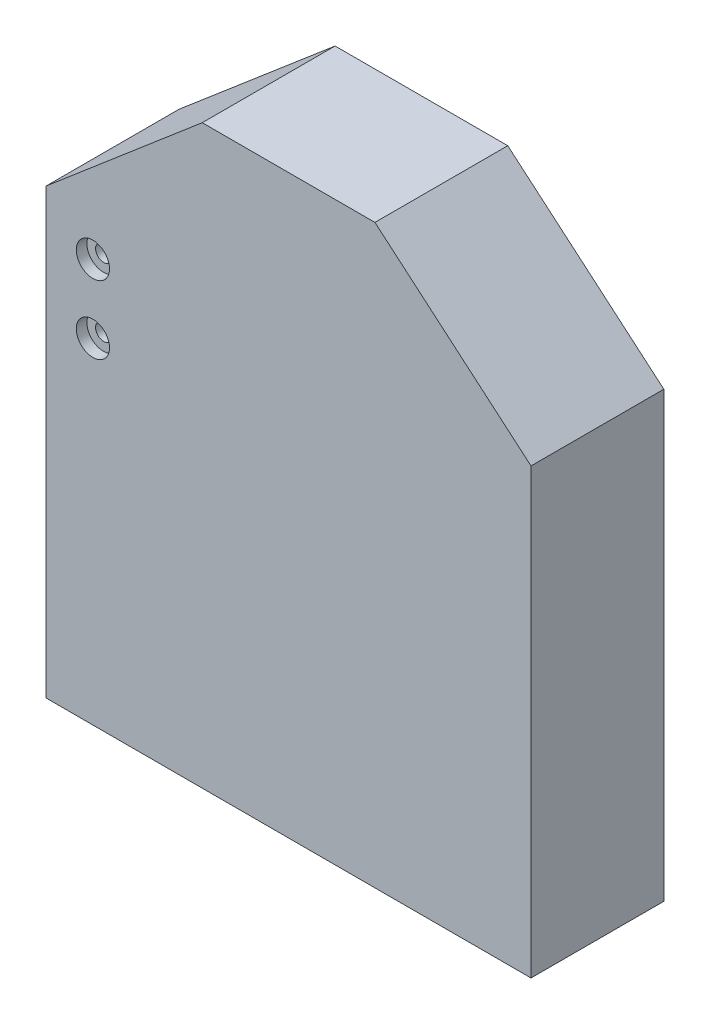
from build123d import *
from build123d.topology import SkipClean

# Parameters (mm, degrees)
BOSS_EXTRUDE5_DEPTH                      = 2
SKETCH1_9_W                              = 14.2
SKETCH1_9_H                              = 15.4
BOSS_EXTRUDE6_DEPTH                      = 12
SKETCH3_R                                = 8.461538462
CUT_EXTRUDE3_DEPTH                       = 12
SKETCH7_W                                = 12
SKETCH7_H                                = 35.1
CUT_EXTRUDE9_DEPTH                       = 3.259623462
SKETCH7_6_W                              = 12
SKETCH7_6_H                              = 35.1
CUT_EXTRUDE10_DEPTH                      = 12
CUT_EXTRUDE11_DEPTH                      = 3.259623462
BOSS_EXTRUDE7_DEPTH                      = 12
BOSS_EXTRUDE8_DEPTH                      = 6
CUT_EXTRUDE14_REACH                      = 66.168
SKETCH9_W                                = 6
SKETCH9_H                                = 24
BOSS_EXTRUDE11_DEPTH                     = 6
BOSS_EXTRUDE11_DEPTH_BACK                = 6
SKETCH6_10_W                             = 12.5
SKETCH6_10_H                             = 8.74037654
CUT_EXTRUDE15_DEPTH                      = 6
CUT_EXTRUDE15_DEPTH_BACK                 = 6
CUT_EXTRUDE16_DEPTH                      = 6
BOSS_EXTRUDE12_DEPTH                     = 6
BOSS_EXTRUDE12_DEPTH_BACK                = 14
CBORE_FOR_M2_PAN_HEAD_SCREW1_D           = 2.4
CBORE_FOR_M2_PAN_HEAD_SCREW1_DEPTH       = 17.6
CBORE_FOR_M2_PAN_HEAD_SCREW1_CBORE_D     = 5
CBORE_FOR_M2_PAN_HEAD_SCREW1_CBORE_DEPTH = 1.6
CBORE_FOR_M2_PAN_HEAD_SCREW1_TIP         = 0.721032743


with BuildPart() as part:
    # Base → Boss-Extrude5 (new body)
    with BuildSketch(Plane.XY):
        Polygon((-13, 50.884615385), (-36.5, 30.884615385), (-36.5, -30.884615385), (36.5, -30.884615385), (36.5, 30.884615385), (13, 50.884615385), align=None)
    extrude(amount=-BOSS_EXTRUDE5_DEPTH)

    # Sketch1<9> → Boss-Extrude6 (add)
    with BuildSketch(Plane.XY):
        Polygon((-13, 50.884615385), (-36.5, 30.884615385), (-36.5, -30.884615385), (36.5, -30.884615385), (36.5, 30.884615385), (13, 50.884615385), align=None)
        Polygon((-11, -27.5), (-21, -27.5), (-21, -0.4), (-29, -0.4), (-29, 3.6), (-21, 3.6), (-21, 5.6), (-11, 5.6), align=None, mode=Mode.SUBTRACT)
        Polygon((21, -27.5), (11, -27.5), (11, 5.6), (21, 5.6), (21, 3.6), (29, 3.6), (29, -0.4), (21, -0.4), align=None, mode=Mode.SUBTRACT)
        with Locations((25.4, 24.8)):
            Rectangle(SKETCH1_9_W, SKETCH1_9_H, mode=Mode.SUBTRACT)
        with Locations((-25.4, 24.8)):
            Rectangle(SKETCH1_9_W, SKETCH1_9_H, mode=Mode.SUBTRACT)
    extrude(amount=BOSS_EXTRUDE6_DEPTH)

    # Toilet → Cut-Revolve2 (revolve, cut)
    with BuildSketch(Plane.YZ):
        with BuildLine():
            Line((46, 12), (33.5, 12))
            Line((33.5, 12), (33.5, 0))
            Line((33.5, 0), (41.961538462, 0))
            Line((41.961538462, 0), (41.961538462, 2.20833333))
            ThreePointArc((41.961538462, 2.20833333), (42.836812261, 6.181610854), (46, 8.74037654))
            Line((46, 8.74037654), (46, 12))
        make_face()
    revolve(axis=Axis((0, 33.5, 12), (0, 0, -1)), mode=Mode.SUBTRACT)

    # Sketch3 → Cut-Extrude3 (cut)
    with BuildSketch(Plane.XY.offset(2.20833333)):
        with Locations((0, 33.5)):
            Circle(SKETCH3_R)
    extrude(amount=-CUT_EXTRUDE3_DEPTH, mode=Mode.SUBTRACT)

    # Sketch7 → Cut-Extrude9 (cut)
    with SkipClean():  # the faces are left unmerged after this step: merging them gives an invalid solid
        with BuildSketch(Plane.XY.offset(12)):
            with Locations((0, -9.95)):
                Rectangle(SKETCH7_W, SKETCH7_H)
            with BuildLine():
                add(Edge.make_bspline(
                    [(16.5, 33.5), (16.5, 48), (0, 48), (-16.5, 48), (-16.5, 33.5)],
                    knots=[3.141592654, 3.141592654, 3.141592654, 4.71238898, 4.71238898, 6.283185307, 6.283185307, 6.283185307], degree=2, weights=[1, 0.707106781, 1, 0.707106781, 1]))
                add(Edge.make_bspline(
                    [(-16.5, 33.5), (-16.5, 19), (0, 19), (16.5, 19), (16.5, 33.5)],
                    knots=[0, 0, 0, 1.570796327, 1.570796327, 3.141592654, 3.141592654, 3.141592654], degree=2, weights=[1, 0.707106781, 1, 0.707106781, 1]))
            make_face()
        extrude(amount=-CUT_EXTRUDE9_DEPTH, mode=Mode.SUBTRACT)
    add(part.part.scale(1), mode=Mode.REPLACE)  # the faces are merged on a copy

    # Sketch7<6> → Cut-Extrude10 (cut)
    with SkipClean():  # the faces are left unmerged after this step: merging them gives an invalid solid
        with BuildSketch(Plane.XY.offset(12)):
            with Locations((0, -9.95)):
                Rectangle(SKETCH7_6_W, SKETCH7_6_H)
        extrude(amount=-CUT_EXTRUDE10_DEPTH, mode=Mode.SUBTRACT)

    # Sketch7<7> → Cut-Extrude11 (cut)
    with SkipClean():  # the faces are left unmerged after this step: merging them gives an invalid solid
        with BuildSketch(Plane.XY.offset(12)):
            with BuildLine():
                ThreePointArc((-11.5, 20.6), (-7.431570475, 14.657797107), (-6, 7.6))
                Line((-6, 7.6), (6, 7.6))
                ThreePointArc((6, 7.6), (7.431570475, 14.657797107), (11.5, 20.6))
                ThreePointArc((11.5, 20.6), (15.206279372, 26.582449856), (16.5, 33.5))
                add(Edge.make_bspline(
                    [(16.5, 33.5), (16.5, 48), (0, 48), (-16.5, 48), (-16.5, 33.5)],
                    knots=[3.141592654, 3.141592654, 3.141592654, 4.71238898, 4.71238898, 6.283185307, 6.283185307, 6.283185307], degree=2, weights=[1, 0.707106781, 1, 0.707106781, 1]))
                ThreePointArc((-16.5, 33.5), (-15.206279372, 26.582449856), (-11.5, 20.6))
            make_face()
        extrude(amount=-CUT_EXTRUDE11_DEPTH, mode=Mode.SUBTRACT)

    # Sketch7<5> → Boss-Extrude7 (add)
    with BuildSketch(Plane.XY.offset(12)):
        Polygon((-6, 7.6), (-9, 7.6), (-9, -30.884615385), (9, -30.884615385), (9, 7.6), (6, 7.6), (6, -27.5), (-6, -27.5), align=None)
    extrude(amount=-BOSS_EXTRUDE7_DEPTH)

    # Sketch8 → Boss-Extrude8 (add)
    with BuildSketch(Plane.XY.offset(12)):
        Polygon((-36.5, 30.884615385), (-36.5, -30.884615385), (36.5, -30.884615385), (36.5, 30.884615385), (13, 50.884615385), (-13, 50.884615385), align=None)
    extrude(amount=BOSS_EXTRUDE8_DEPTH)

    # Sketch9 → Cut-Extrude14 (cut, up to next)
    with BuildSketch(Plane.XY.offset(12), mode=Mode.PRIVATE) as cut_extrude14_sk1:
        with Locations((-26, 1.6)):
            Rectangle(SKETCH9_W, SKETCH9_H)
    cut_extrude14_tool1 = extrude(cut_extrude14_sk1.sketch, amount=-CUT_EXTRUDE14_REACH, mode=Mode.PRIVATE) & part.part
    # Sketch9 → Cut-Extrude14 (cut, up to next)
    with BuildSketch(Plane.XY.offset(12), mode=Mode.PRIVATE) as cut_extrude14_sk2:
        with Locations((26, 1.6)):
            Rectangle(SKETCH9_W, SKETCH9_H)
    cut_extrude14_tool2 = extrude(cut_extrude14_sk2.sketch, amount=-CUT_EXTRUDE14_REACH, mode=Mode.PRIVATE) & part.part
    add(cut_extrude14_tool1.solids().sort_by_distance((-26, 1.6, 12))[0], mode=Mode.SUBTRACT)
    add(cut_extrude14_tool2.solids().sort_by_distance((26, 1.6, 12))[0], mode=Mode.SUBTRACT)

    # Sketch6<10> → Boss-Extrude11 (add, two sides: drawn at the far end of the back side and taken through both)
    with BuildSketch(Plane.YZ.offset(-BOSS_EXTRUDE11_DEPTH_BACK)):
        with Locations((1.35, 4.37018827)):
            Rectangle(SKETCH6_10_W, SKETCH6_10_H)
    extrude(amount=BOSS_EXTRUDE11_DEPTH + BOSS_EXTRUDE11_DEPTH_BACK)

    # Sketch6<11> → Cut-Extrude15 (cut, two sides: drawn at the far end of the back side and taken through both)
    with BuildSketch(Plane.YZ.offset(-CUT_EXTRUDE15_DEPTH_BACK)):
        with BuildLine():
            ThreePointArc((4.061538462, 2.20833333), (4.733917765, 6.068528397), (7.6, 8.74037654))
            Line((7.6, 8.74037654), (-4.9, 8.74037654))
            Line((-4.9, 8.74037654), (-4.9, 0))
            Line((-4.9, 0), (4.061538462, 0))
            Line((4.061538462, 0), (4.061538462, 2.20833333))
        make_face()
    extrude(amount=CUT_EXTRUDE15_DEPTH + CUT_EXTRUDE15_DEPTH_BACK, mode=Mode.SUBTRACT)

    # Sketch1<10> → Cut-Extrude16 (cut)
    with BuildSketch(Plane.XY):
        Polygon((-32.5, 27.5), (-32.5, 22.1), (-26.5, 22.1), (-26.5, 17.1), (-22.3, 17.1), (-22.3, 32.5), (-26.5, 32.5), (-26.5, 27.5), align=None)
        Polygon((22.3, 32.5), (22.3, 17.1), (26.5, 17.1), (26.5, 22.1), (32.5, 22.1), (32.5, 27.5), (26.5, 27.5), (26.5, 32.5), align=None)
    extrude(amount=-CUT_EXTRUDE16_DEPTH, mode=Mode.SUBTRACT)

    # Sketch13 → Boss-Extrude12 (add, two sides: drawn at the far end of the back side and taken through both)
    with BuildSketch(Plane.XY.offset(12).offset(-BOSS_EXTRUDE12_DEPTH_BACK)):
        Polygon((36.5, 30.884615385), (36.5, 35.884615385), (13, 55.884615385), (-13, 55.884615385), (-36.5, 35.884615385), (-36.5, 30.884615385), (-13, 50.884615385), (13, 50.884615385), align=None)
    extrude(amount=BOSS_EXTRUDE12_DEPTH + BOSS_EXTRUDE12_DEPTH_BACK)

    # CBORE for M2 Pan Head Screw1
    with Locations(Plane.XY.offset(18)):
        with Locations((-29.4609494, 19.541765916), (-29.4609494, 29.838702579)):
            CounterBoreHole(CBORE_FOR_M2_PAN_HEAD_SCREW1_D / 2, CBORE_FOR_M2_PAN_HEAD_SCREW1_CBORE_D / 2, CBORE_FOR_M2_PAN_HEAD_SCREW1_CBORE_DEPTH, depth=CBORE_FOR_M2_PAN_HEAD_SCREW1_DEPTH)
            with Locations((0, 0, -(CBORE_FOR_M2_PAN_HEAD_SCREW1_DEPTH + CBORE_FOR_M2_PAN_HEAD_SCREW1_TIP / 2))):  # 118° drill point
                Cone(0, CBORE_FOR_M2_PAN_HEAD_SCREW1_D / 2, CBORE_FOR_M2_PAN_HEAD_SCREW1_TIP, mode=Mode.SUBTRACT)


solid = part.part
